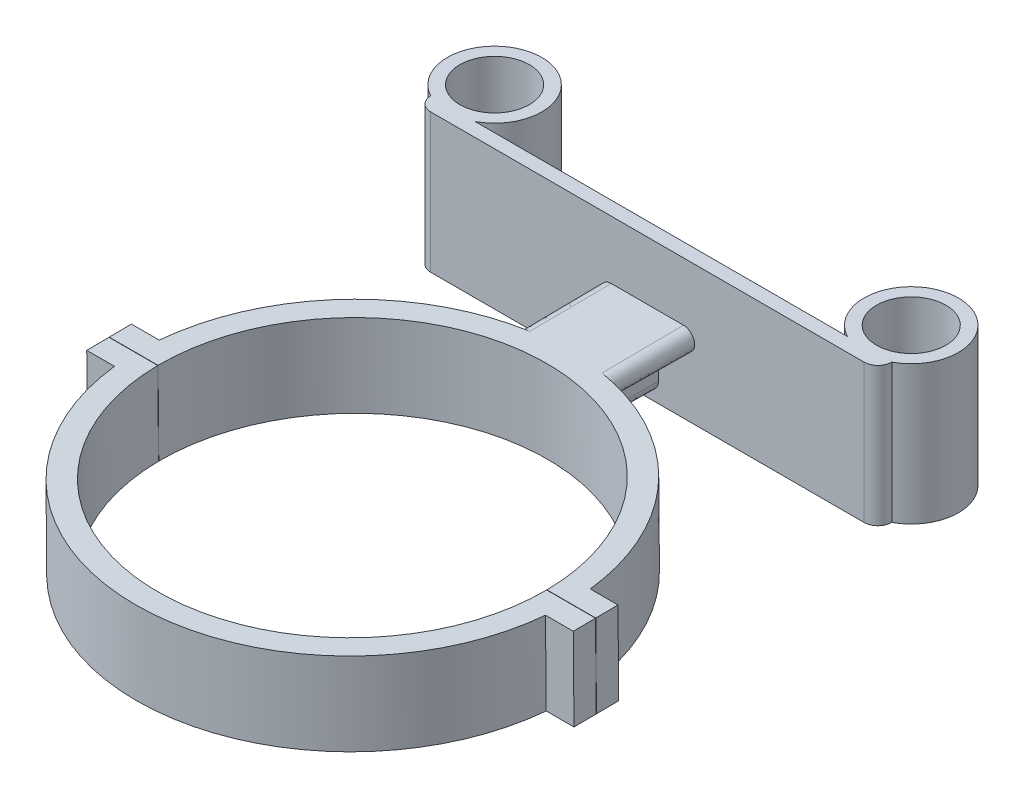
from build123d import *

# Parameters (mm, degrees)
SKETCH_1_W                  = 166
SKETCH_1_H                  = 50
EXTRUDE_1_DEPTH             = 5
EXTRUDE_4_REACH             = 88.827
SKETCH_4_R                  = 12.5
EXTRUDE_4_DIRECTION_2_REACH = 88.827
FILLET_1_R                  = 5
EXTRUDE_2_DEPTH             = 30
EXTRUDE_2_TAPER             = 0.5
EXTRUDE_3_DEPTH             = 30


with BuildPart() as part:
    # Эскиз1 → Бобышка-Вытянуть1 (new body)
    with BuildSketch(Plane.XY):
        Rectangle(SKETCH_1_W, SKETCH_1_H)
    extrude(amount=EXTRUDE_1_DEPTH)

    # Бобышка-Вытянуть4: up to this face of the body (flat: up to its plane)
    extrude_4_end = Plane(part.part.faces().sort_by_distance((0, 25, 2.5))[0])
    # Эскиз4 → Бобышка-Вытянуть4 (add, up to the picked face)
    with BuildSketch(Plane(origin=(0, 0, 0), x_dir=(1, 0, 0), z_dir=(0, 1, 0)), mode=Mode.PRIVATE) as extrude_4_sk1:
        with BuildLine():
            Line((-83, 0), (-67, 0))
            ThreePointArc((-67, 0), (-75, 32), (-83, 0))
        make_face()
        with Locations(Location((-75, 15, 0), (0, 0, 90))):
            Circle(SKETCH_4_R, mode=Mode.SUBTRACT)
    extrude_4_tool1 = split(extrude(extrude_4_sk1.sketch, amount=EXTRUDE_4_REACH, mode=Mode.PRIVATE), bisect_by=extrude_4_end, keep=Keep.BOTH, mode=Mode.PRIVATE)
    # Эскиз4 → Бобышка-Вытянуть4 (add, up to the picked face)
    with BuildSketch(Plane(origin=(0, 0, 0), x_dir=(1, 0, 0), z_dir=(0, 1, 0)), mode=Mode.PRIVATE) as extrude_4_sk2:
        with BuildLine():
            Line((83, 0), (67, 0))
            ThreePointArc((67, 0), (75, 32), (83, 0))
        make_face()
        with Locations(Location((75, 15, 0), (0, 0, 90))):
            Circle(SKETCH_4_R, mode=Mode.SUBTRACT)
    extrude_4_tool2 = split(extrude(extrude_4_sk2.sketch, amount=EXTRUDE_4_REACH, mode=Mode.PRIVATE), bisect_by=extrude_4_end, keep=Keep.BOTH, mode=Mode.PRIVATE)
    add(extrude_4_tool1.solids().sort_by(Axis((-75, 0, -31.533095), (0, 1, 0)))[0])
    add(extrude_4_tool2.solids().sort_by(Axis((75, 0, -31.533095), (0, 1, 0)))[0])

    # Бобышка-Вытянуть4 direction 2: up to this face of the body (flat: up to its plane)
    extrude_4_direction_2_end = Plane(part.part.faces().sort_by_distance((0, -25, 2.5))[0])
    # Эскиз4 → Бобышка-Вытянуть4 direction 2 (add, up to the picked face)
    with BuildSketch(Plane(origin=(0, 0, 0), x_dir=(1, 0, 0), z_dir=(0, 1, 0)), mode=Mode.PRIVATE) as extrude_4_direction_2_sk1:
        with BuildLine():
            Line((-83, 0), (-67, 0))
            ThreePointArc((-67, 0), (-75, 32), (-83, 0))
        make_face()
        with Locations(Location((-75, 15, 0), (0, 0, 90))):
            Circle(SKETCH_4_R, mode=Mode.SUBTRACT)
    extrude_4_direction_2_tool1 = split(extrude(extrude_4_direction_2_sk1.sketch, amount=-EXTRUDE_4_DIRECTION_2_REACH, mode=Mode.PRIVATE), bisect_by=extrude_4_direction_2_end, keep=Keep.BOTH, mode=Mode.PRIVATE)
    # Эскиз4 → Бобышка-Вытянуть4 direction 2 (add, up to the picked face)
    with BuildSketch(Plane(origin=(0, 0, 0), x_dir=(1, 0, 0), z_dir=(0, 1, 0)), mode=Mode.PRIVATE) as extrude_4_direction_2_sk2:
        with BuildLine():
            Line((83, 0), (67, 0))
            ThreePointArc((67, 0), (75, 32), (83, 0))
        make_face()
        with Locations(Location((75, 15, 0), (0, 0, 90))):
            Circle(SKETCH_4_R, mode=Mode.SUBTRACT)
    extrude_4_direction_2_tool2 = split(extrude(extrude_4_direction_2_sk2.sketch, amount=-EXTRUDE_4_DIRECTION_2_REACH, mode=Mode.PRIVATE), bisect_by=extrude_4_direction_2_end, keep=Keep.BOTH, mode=Mode.PRIVATE)
    add(extrude_4_direction_2_tool1.solids().sort_by(Axis((-75, 0, -31.533095), (0, -1, 0)))[0])
    add(extrude_4_direction_2_tool2.solids().sort_by(Axis((75, 0, -31.533095), (0, -1, 0)))[0])

    # Скругление1
    fillet_1_edges = [part.edges().sort_by_distance(p)[0] for p in [
        (83, 0, 5),
        (-83, 0, 5),
    ]]
    fillet(fillet_1_edges, radius=FILLET_1_R - 0.0001)  # a hair under: the kernel refuses the full size

    # Эскиз2 → Бобышка-Вытянуть2 (add)
    with BuildSketch(Plane.XY.offset(5)):
        with BuildLine():
            ThreePointArc((-13, 4), (-17, 0), (-13, -4))
            Line((-13, -4), (-5, -4))
            ThreePointArc((-5, -4), (-4.292893219, -4.292893219), (-4, -5))
            Line((-4, -5), (-4, -18))
            ThreePointArc((-4, -18), (0, -22), (4, -18))
            Line((4, -18), (4, -5))
            ThreePointArc((4, -5), (4.292893219, -4.292893219), (5, -4))
            Line((5, -4), (13, -4))
            ThreePointArc((13, -4), (17, 0), (13, 4))
            Line((13, 4), (-13, 4))
        make_face()
    extrude(amount=EXTRUDE_2_DEPTH, taper=EXTRUDE_2_TAPER)

    # Эскиз3 → Бобышка-Вытянуть3 (add)
    with BuildSketch(Plane(origin=(0, 4.043326406, 0.035285575), x_dir=(1, 0, 0), z_dir=(0, 0.9999619230641713, 0.008726535498373954))):
        with BuildLine():
            Line((69.999982143, -111.131560673), (87.583487289, -111.131560673))
            Line((87.583487289, -111.131560673), (87.583487289, -103.131560673))
            Line((87.583487289, -103.131560673), (77.583487289, -103.131560673))
            ThreePointArc((77.583487289, -103.131560673), (0, -33.181560673), (-77.583487289, -103.131560673))
            Line((-77.583487289, -103.131560673), (-87.583487289, -103.131560673))
            Line((-87.583487289, -103.131560673), (-87.583487289, -111.131560673))
            Line((-87.583487289, -111.131560673), (-69.999982143, -111.131560673))
            ThreePointArc((-69.999982143, -111.131560673), (0, -41.181560673), (69.999982143, -111.131560673))
        make_face()
        with BuildLine():
            Line((-87.583487289, -111.231560673), (-69.999982143, -111.231560673))
            ThreePointArc((-69.999982143, -111.231560673), (0, -181.181560673), (69.999982143, -111.231560673))
            Line((69.999982143, -111.231560673), (87.583487289, -111.231560673))
            Line((87.583487289, -111.231560673), (87.583487289, -119.231560673))
            Line((87.583487289, -119.231560673), (77.583487289, -119.231560673))
            ThreePointArc((77.583487289, -119.231560673), (0, -189.181560673), (-77.583487289, -119.231560673))
            Line((-77.583487289, -119.231560673), (-87.583487289, -119.231560673))
            Line((-87.583487289, -119.231560673), (-87.583487289, -111.231560673))
        make_face()
    extrude(amount=-EXTRUDE_3_DEPTH)


with BuildPart() as extrude_3_piece_1:
    # of the separate pieces the step leaves, piece 1, a body of its own (extrude_3_pieces)
    add(part.part.solids().sort_by_distance((-83, 25, 0.0001))[0])


with BuildPart() as extrude_3_piece_2:
    # of the separate pieces the step leaves, piece 2, a body of its own (extrude_3_pieces)
    add(part.part.solids().sort_by_distance((-77.583487289, 3.00284796, 119.262306276))[0])


solid = Compound([extrude_3_piece_1.part, extrude_3_piece_2.part])
